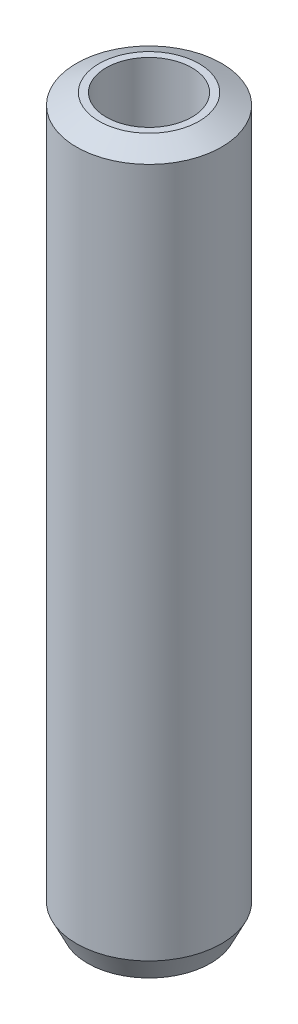
from build123d import *
from OCP.BRepFilletAPI import BRepFilletAPI_MakeChamfer

# Parameters (mm, degrees)
SKETCH1_R           = 22.5
BOSS_EXTRUDE1_DEPTH = 224.320014759
SKETCH2_R           = 13.287965747
CUT_EXTRUDE1_DEPTH  = 227.565595405
CHAMFER1_SIZE       = 3.42862666
CHAMFER1_SIZE2      = 6.99568794


with BuildPart() as part:
    # Sketch1 → Boss-Extrude1 (new body)
    with BuildSketch(Plane(origin=(0, 0, 0), x_dir=(1, 0, 0), z_dir=(0, 1, 0))):
        Circle(SKETCH1_R)
    extrude(amount=BOSS_EXTRUDE1_DEPTH)

    # Sketch2 → Cut-Extrude1 (cut, through all)
    with BuildSketch(Plane(origin=(0, 0, 0), x_dir=(1, 0, 0), z_dir=(0, 1, 0))):
        Circle(SKETCH2_R)
    extrude(amount=CUT_EXTRUDE1_DEPTH, mode=Mode.SUBTRACT)

    # Chamfer1: one chamfer whose edges measure the first distance from different faces: ONE call of the kernel's chamfer builder (chamfer() names one face for all edges)
    chamfer1_edges_1 = [part.edges().sort_by_distance(p)[0] for p in [
        (-22.5, 224.320014759, 0),
    ]]
    chamfer1_side_1 = [part.faces().sort_by_distance(p)[0] for p in [
        (-22.5, 112.160007379, 0),
    ]]
    chamfer1_edges_2 = [part.edges().sort_by_distance(p)[0] for p in [
        (-22.5, 0, 0),
    ]]
    chamfer1_side_2 = [part.faces().sort_by_distance(p)[0] for p in [
        (-21.863603897, 0, 0),
    ]]
    chamfer1 = BRepFilletAPI_MakeChamfer(part.part.solid().wrapped)
    for e in chamfer1_edges_1:
        chamfer1.Add(CHAMFER1_SIZE, CHAMFER1_SIZE2, e.wrapped, chamfer1_side_1[0].wrapped)  # the first distance lies on this face
    for e in chamfer1_edges_2:
        chamfer1.Add(CHAMFER1_SIZE, CHAMFER1_SIZE2, e.wrapped, chamfer1_side_2[0].wrapped)  # the first distance lies on this face
    add(Compound.cast(chamfer1.Shape()), mode=Mode.REPLACE)


solid = part.part
